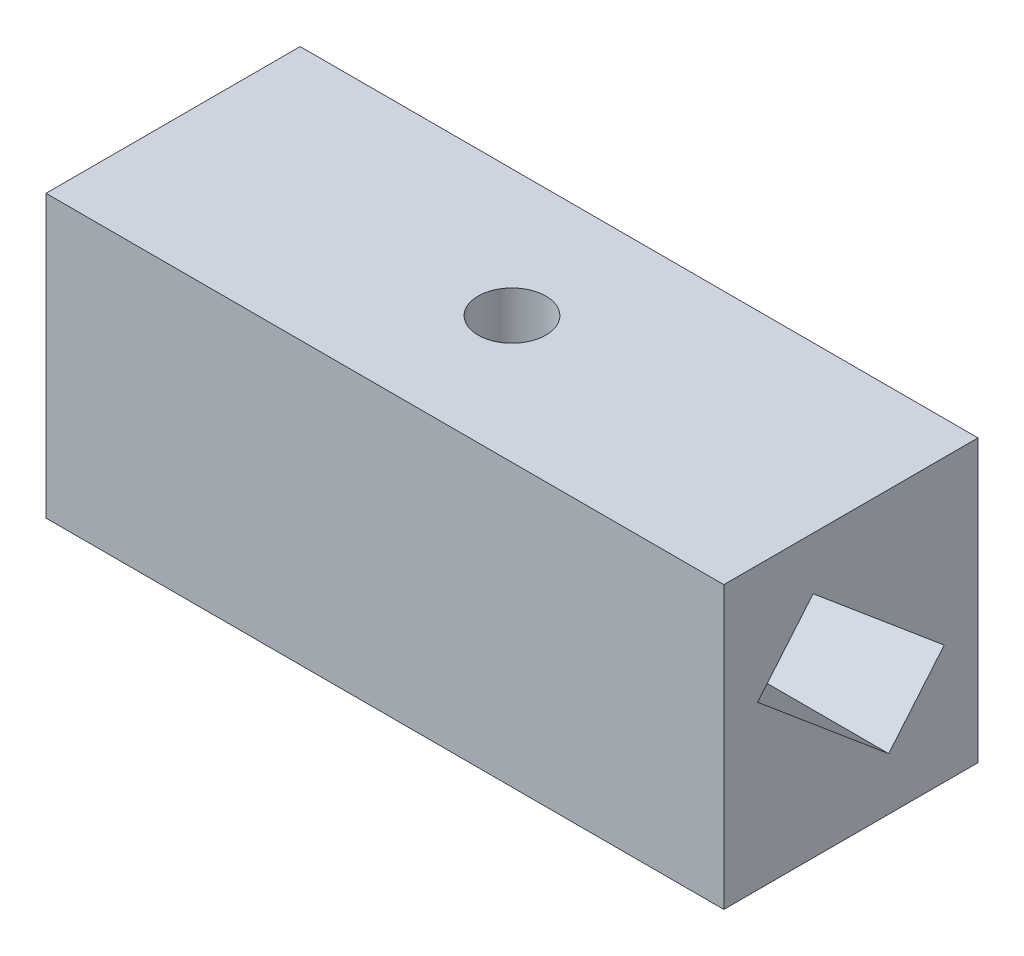
from build123d import *

# Parameters (mm, degrees)
SKETCH_1_W          = 80
SKETCH_1_H          = 30
EXTRUDE_1_DEPTH     = 33.2
SKETCH_2_R          = 4
CUT_EXTRUDE_1_DEPTH = 55.103973976
CUT_EXTRUDE_4_DEPTH = 30
CUT_EXTRUDE_5_DEPTH = 30


with BuildPart() as part:
    # Эскиз1 → Бобышка-Вытянуть1 (new body)
    with BuildSketch(Plane(origin=(0, 0, 0), x_dir=(1, 0, 0), z_dir=(0, 1, 0))):
        Rectangle(SKETCH_1_W, SKETCH_1_H)
    extrude(amount=EXTRUDE_1_DEPTH)

    # Эскиз2 → Вырез-Вытянуть1 (cut, through all)
    with BuildSketch(Plane(origin=(0, 33.2, 0), x_dir=(1, 0, 0), z_dir=(0, 1, 0))):
        Circle(SKETCH_2_R)
    extrude(amount=-CUT_EXTRUDE_1_DEPTH, mode=Mode.SUBTRACT)

    # Эскиз5 → Вырез-Вытянуть4 (cut)
    with BuildSketch(Plane.ZY.offset(40)):
        Polygon((-11.015265685, 14.014671802), (-4.458832066, 6.201018482), (11.015265685, 19.185328198), (4.458832066, 26.998981518), align=None)
    extrude(amount=-CUT_EXTRUDE_4_DEPTH, mode=Mode.SUBTRACT)

    # Эскиз6 → Вырез-Вытянуть5 (cut)
    with BuildSketch(Plane(origin=(40, 0, 0), x_dir=(0, 0, -1), z_dir=(1, 0, 0))):
        Polygon((11.015265685, 14.014671802), (4.458832066, 6.201018482), (-11.015265685, 19.185328198), (-4.458832066, 26.998981518), align=None)
    extrude(amount=-CUT_EXTRUDE_5_DEPTH, mode=Mode.SUBTRACT)


solid = part.part
